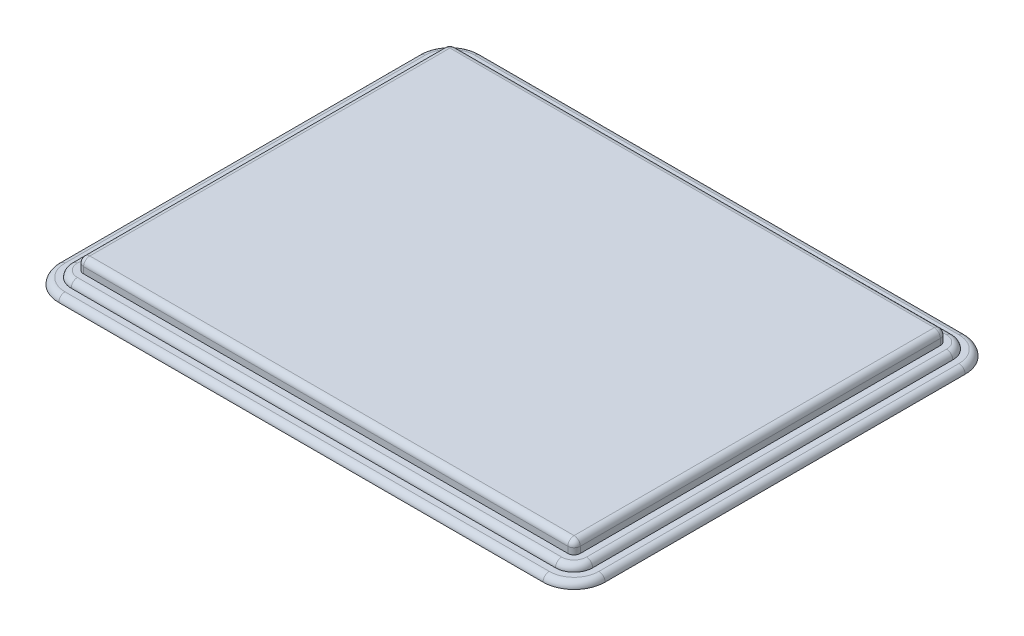
from build123d import *

# Parameters (mm, degrees)
BOSS_EXTRUDE1_DEPTH = 100
FILLET1_R           = 50
BOSS_EXTRUDE2_START = 50
BOSS_EXTRUDE2_DEPTH = 50
BOSS_EXTRUDE3_START = 50
BOSS_EXTRUDE3_DEPTH = 50
FILLET2_R           = 50


with BuildPart() as part:
    # Sketch1 → Boss-Extrude1 (new body)
    with BuildSketch(Plane(origin=(0, 0, 0), x_dir=(1, 0, 0), z_dir=(0, 1, 0))):
        with BuildLine():
            Line((-1950, 1500), (1950, 1500))
            ThreePointArc((1950, 1500), (1985.355339059, 1485.355339059), (2000, 1450))
            Line((2000, 1450), (2000, -1450))
            ThreePointArc((2000, -1450), (1985.355339059, -1485.355339059), (1950, -1500))
            Line((1950, -1500), (-1950, -1500))
            ThreePointArc((-1950, -1500), (-1985.355339059, -1485.355339059), (-2000, -1450))
            Line((-2000, -1450), (-2000, 1450))
            ThreePointArc((-2000, 1450), (-1985.355339059, 1485.355339059), (-1950, 1500))
        make_face()
    extrude(amount=BOSS_EXTRUDE1_DEPTH)

    # Fillet1
    fillet1_edges = [part.edges().sort_by_distance(p)[0] for p in [
        (-1985.355339059, 100, -1485.355339059),
        (-2000, 100, 0),
        (-1985.355339059, 100, 1485.355339059),
        (0, 100, 1500),
        (1985.355339059, 100, 1485.355339059),
        (2000, 100, 0),
        (1985.355339059, 100, -1485.355339059),
        (0, 100, -1500),
    ]]
    fillet(fillet1_edges, radius=FILLET1_R)

    # Sketch2 → Boss-Extrude2 (add)
    # profile 1 of 2: a face of its own
    with BuildSketch(Plane.XZ.offset(BOSS_EXTRUDE2_START)):
        with BuildLine():
            Line((1950, 1600), (-1950, 1600))
            ThreePointArc((-1950, 1600), (-2056.066017178, 1556.066017178), (-2100, 1450))
            Line((-2100, 1450), (-2100, -1450))
            ThreePointArc((-2100, -1450), (-2056.066017178, -1556.066017178), (-1950, -1600))
            Line((-1950, -1600), (1950, -1600))
            ThreePointArc((1950, -1600), (2056.066017178, -1556.066017178), (2100, -1450))
            Line((2100, -1450), (2100, 1450))
            ThreePointArc((2100, 1450), (2056.066017178, 1556.066017178), (1950, 1600))
        make_face()
        with BuildLine():
            ThreePointArc((1950, -1500), (1985.355339059, -1485.355339059), (2000, -1450))
            Line((2000, -1450), (2000, 1450))
            ThreePointArc((2000, 1450), (1985.355339059, 1485.355339059), (1950, 1500))
            Line((1950, 1500), (-1950, 1500))
            ThreePointArc((-1950, 1500), (-1985.355339059, 1485.355339059), (-2000, 1450))
            Line((-2000, 1450), (-2000, -1450))
            ThreePointArc((-2000, -1450), (-1985.355339059, -1485.355339059), (-1950, -1500))
            Line((-1950, -1500), (1950, -1500))
        make_face(mode=Mode.SUBTRACT)
    # profile 2 of 2: a face of its own
    with BuildSketch(Plane.XZ.offset(BOSS_EXTRUDE2_START)):
        with BuildLine():
            Line((-1950, -1500), (1950, -1500))
            ThreePointArc((1950, -1500), (1985.355339059, -1485.355339059), (2000, -1450))
            Line((2000, -1450), (2000, 1450))
            ThreePointArc((2000, 1450), (1985.355339059, 1485.355339059), (1950, 1500))
            Line((1950, 1500), (-1950, 1500))
            ThreePointArc((-1950, 1500), (-1985.355339059, 1485.355339059), (-2000, 1450))
            Line((-2000, 1450), (-2000, -1450))
            ThreePointArc((-2000, -1450), (-1985.355339059, -1485.355339059), (-1950, -1500))
        make_face()
    extrude(amount=-BOSS_EXTRUDE2_DEPTH)

    # Sketch3 → Boss-Extrude3 (add)
    # profile 1 of 2: a face of its own
    with BuildSketch(Plane.XZ.offset(50).offset(BOSS_EXTRUDE3_START)):
        with BuildLine():
            Line((1950, 1700), (-1950, 1700))
            ThreePointArc((-1950, 1700), (-2126.776695297, 1626.776695297), (-2200, 1450))
            Line((-2200, 1450), (-2200, -1450))
            ThreePointArc((-2200, -1450), (-2126.776695297, -1626.776695297), (-1950, -1700))
            Line((-1950, -1700), (1950, -1700))
            ThreePointArc((1950, -1700), (2126.776695297, -1626.776695297), (2200, -1450))
            Line((2200, -1450), (2200, 1450))
            ThreePointArc((2200, 1450), (2126.776695297, 1626.776695297), (1950, 1700))
        make_face()
        with BuildLine():
            Line((1950, 1600), (-1950, 1600))
            ThreePointArc((-1950, 1600), (-2056.066017178, 1556.066017178), (-2100, 1450))
            Line((-2100, 1450), (-2100, -1450))
            ThreePointArc((-2100, -1450), (-2056.066017178, -1556.066017178), (-1950, -1600))
            Line((-1950, -1600), (1950, -1600))
            ThreePointArc((1950, -1600), (2056.066017178, -1556.066017178), (2100, -1450))
            Line((2100, -1450), (2100, 1450))
            ThreePointArc((2100, 1450), (2056.066017178, 1556.066017178), (1950, 1600))
        make_face(mode=Mode.SUBTRACT)
    # profile 2 of 2: a face of its own
    with BuildSketch(Plane.XZ.offset(50).offset(BOSS_EXTRUDE3_START)):
        with BuildLine():
            ThreePointArc((2100, 1450), (2056.066017178, 1556.066017178), (1950, 1600))
            Line((1950, 1600), (-1950, 1600))
            ThreePointArc((-1950, 1600), (-2056.066017178, 1556.066017178), (-2100, 1450))
            Line((-2100, 1450), (-2100, -1450))
            ThreePointArc((-2100, -1450), (-2056.066017178, -1556.066017178), (-1950, -1600))
            Line((-1950, -1600), (1950, -1600))
            ThreePointArc((1950, -1600), (2056.066017178, -1556.066017178), (2100, -1450))
            Line((2100, -1450), (2100, 1450))
        make_face()
    extrude(amount=-BOSS_EXTRUDE3_DEPTH)

    # Fillet2
    fillet2_edges = [part.edges().sort_by_distance(p)[0] for p in [
        (2126.776695297, -50, -1626.776695297),
        (0, -50, -1700),
        (-2126.776695297, -50, -1626.776695297),
        (-2200, -50, 0),
        (-2126.776695297, -50, 1626.776695297),
        (0, -50, 1700),
        (2126.776695297, -50, 1626.776695297),
        (2056.066017178, 0, -1556.066017178),
        (0, 0, -1600),
        (-2056.066017178, 0, -1556.066017178),
        (-2100, 0, 0),
        (-2056.066017178, 0, 1556.066017178),
        (0, 0, 1600),
        (2056.066017178, 0, 1556.066017178),
        (2200, -50, 0),
        (2100, 0, 0),
    ]]
    fillet(fillet2_edges, radius=FILLET2_R - 0.0001)  # a hair under: the kernel refuses the full size


solid = part.part
